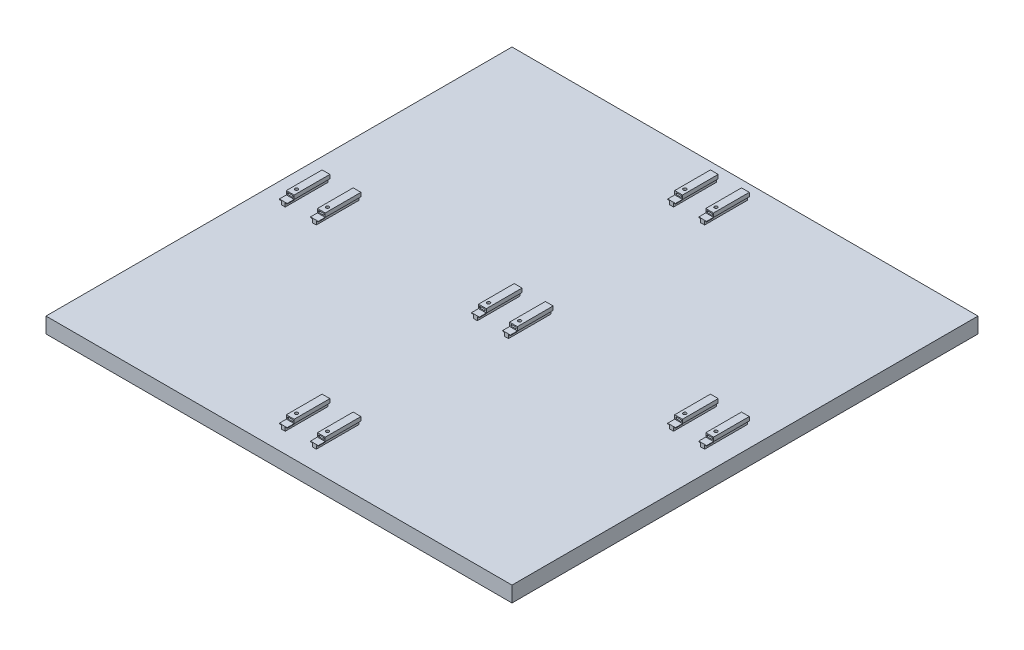
from build123d import *
from build123d.topology import SkipClean

# Parameters (mm, degrees)
SKETCH1_W                   = 300
SKETCH1_H                   = 300
BOSS_EXTRUDE1_DEPTH         = 10
SHELL5_T                    = -3
BOSS_EXTRUDE2_DEPTH         = 13.75
SKETCH5_W                   = 51.63175717
SKETCH5_H                   = 2.8
CUT_EXTRUDE1_DEPTH          = 4.5
SKETCH6_W                   = 5
SKETCH6_H                   = 4.5
BOSS_EXTRUDE3_DEPTH         = 0.35
SKETCH7_W                   = 3.5
SKETCH7_H                   = 1
CUT_EXTRUDE2_DEPTH          = 3.5
F_2_0_2_DIAMETER_HOLE2_D    = 2
SKETCH_PATTERN2_START       = 7
SKETCH_PATTERN2_OUTLINE_R   = 1
SKETCH_PATTERN2_DEPTH       = 3
SKETCH_PATTERN2_START_2     = 12.6
SKETCH_PATTERN2_2_DEPTH     = 2.5
SKETCH_PATTERN2_START_3     = 10
SKETCH_PATTERN2_3_OUTLINE_W = 2.5
SKETCH_PATTERN2_3_OUTLINE_H = 27.5
SKETCH_PATTERN2_3_OUTLINE_R = 1
SKETCH_PATTERN2_3_DEPTH     = 2.65
SKETCH_PATTERN2_START_4     = 14.35
SKETCH_PATTERN2_4_DEPTH     = 0.75
SKETCH_PATTERN2_5_DEPTH     = 0.75
SKETCH_PATTERN2_START_5     = 12.3
SKETCH_PATTERN2_6_OUTLINE_W = 1.25
SKETCH_PATTERN2_6_OUTLINE_H = 4.5
SKETCH_PATTERN2_6_DEPTH     = 0.35


# Read off the part's stored shape, not the designer's step: Sketch-Pattern2
with BuildPart() as part:
    # Sketch1 → Boss-Extrude1 (new body)
    with BuildSketch(Plane(origin=(0, 0, 0), x_dir=(1, 0, 0), z_dir=(0, 1, 0))):
        Rectangle(SKETCH1_W, SKETCH1_H)
    extrude(amount=BOSS_EXTRUDE1_DEPTH)

    # Shell5
    shell5_openings = [part.faces().sort_by_distance(p)[0] for p in [
        (0, 0, 0),
    ]]
    offset(amount=SHELL5_T, openings=shell5_openings, kind=Kind.INTERSECTION)

    # Sketch2 → Boss-Extrude2 (add, symmetric)
    with BuildSketch(Plane.XY):
        Polygon((-11.034760645, 10), (-11.034760645, 12.6), (-12.284760645, 12.6), (-12.284760645, 15.1), (-7.284760645, 15.1), (-7.284760645, 12.6), (-8.534760645, 12.6), (-8.534760645, 10), align=None)
        Polygon((8.965239355, 10), (11.465239355, 10), (11.465239355, 12.6), (12.715239355, 12.6), (12.715239355, 15.1), (7.715239355, 15.1), (7.715239355, 12.6), (8.965239355, 12.6), align=None)
    extrude(amount=BOSS_EXTRUDE2_DEPTH, both=True)

    # Sketch5 → Cut-Extrude1 (cut)
    with BuildSketch(Plane.XY.offset(13.75)):
        with Locations((-9.472877717, 13.7)):
            Rectangle(SKETCH5_W, SKETCH5_H)
        with Locations((17.311892559, -46.179704591)):
            Rectangle(SKETCH5_W, SKETCH5_H)
    extrude(amount=-CUT_EXTRUDE1_DEPTH, mode=Mode.SUBTRACT)

    # Sketch6 → Boss-Extrude3 (add)
    with BuildSketch(Plane(origin=(0, 12.3, 0), x_dir=(1, 0, 0), z_dir=(0, 1, 0))):
        with Locations((10.215239355, -11.5)):
            Rectangle(SKETCH6_W, SKETCH6_H)
        with Locations((-9.784760645, -11.5)):
            Rectangle(SKETCH6_W, SKETCH6_H)
    extrude(amount=BOSS_EXTRUDE3_DEPTH)

    # Sketch7 → Cut-Extrude2 (cut)
    with BuildSketch(Plane.XY.offset(9.25)):
        with Locations((10.215239355, 13.85)):
            Rectangle(SKETCH7_W, SKETCH7_H)
        with Locations((-9.784760645, 13.85)):
            Rectangle(SKETCH7_W, SKETCH7_H)
    extrude(amount=-CUT_EXTRUDE2_DEPTH, mode=Mode.SUBTRACT)

    # Ø2.0 (2) Diameter Hole2 (through all)
    with Locations(Plane(origin=(0, 15.1, 0), x_dir=(1, 0, 0), z_dir=(0, 1, 0))):
        with Locations((-9.784760645, -5.25), (10.215239355, -5.25)):
            Hole(F_2_0_2_DIAMETER_HOLE2_D / 2)

    # Sketch-Pattern2 outline → Sketch-Pattern2 (cut)
    with BuildSketch(Plane(origin=(0, 0, 0), x_dir=(1, 0, 0), z_dir=(0, 1, 0)).offset(SKETCH_PATTERN2_START)):
        with Locations((115, -3.75)):
            Circle(SKETCH_PATTERN2_OUTLINE_R)
        with Locations((135, -3.75)):
            Circle(SKETCH_PATTERN2_OUTLINE_R)
        with Locations((-135, -3.75)):
            Circle(SKETCH_PATTERN2_OUTLINE_R)
        with Locations((-115, -3.75)):
            Circle(SKETCH_PATTERN2_OUTLINE_R)
        with Locations((-10, -128.75)):
            Circle(SKETCH_PATTERN2_OUTLINE_R)
        with Locations((10, -128.75)):
            Circle(SKETCH_PATTERN2_OUTLINE_R)
        with Locations((-10, 121.25)):
            Circle(SKETCH_PATTERN2_OUTLINE_R)
        with Locations((10, 121.25)):
            Circle(SKETCH_PATTERN2_OUTLINE_R)
    extrude(amount=SKETCH_PATTERN2_DEPTH, mode=Mode.SUBTRACT)



with BuildPart() as body_2:
    # Sketch-Pattern2 2 outline → Sketch-Pattern2 2 (new body)
    with BuildSketch(Plane(origin=(0, 0, 0), x_dir=(1, 0, 0), z_dir=(0, 1, 0)).offset(SKETCH_PATTERN2_START_2)):
        with BuildLine():
            Line((115.866025404, -4.25), (116.75, -4.25))
            Line((116.75, -4.25), (116.75, -7.75))
            Line((116.75, -7.75), (117.5, -7.75))
            Line((117.5, -7.75), (117.5, 15.25))
            Line((117.5, 15.25), (112.5, 15.25))
            Line((112.5, 15.25), (112.5, -7.75))
            Line((112.5, -7.75), (113.25, -7.75))
            Line((113.25, -7.75), (113.25, -4.25))
            Line((113.25, -4.25), (114.133974596, -4.25))
            ThreePointArc((114.133974596, -4.25), (115, -2.75), (115.866025404, -4.25))
        make_face()
        with BuildLine():
            Line((135.866025404, -4.25), (136.75, -4.25))
            Line((136.75, -4.25), (136.75, -7.75))
            Line((136.75, -7.75), (137.5, -7.75))
            Line((137.5, -7.75), (137.5, 15.25))
            Line((137.5, 15.25), (132.5, 15.25))
            Line((132.5, 15.25), (132.5, -7.75))
            Line((132.5, -7.75), (133.25, -7.75))
            Line((133.25, -7.75), (133.25, -4.25))
            Line((133.25, -4.25), (134.133974596, -4.25))
            ThreePointArc((134.133974596, -4.25), (135, -2.75), (135.866025404, -4.25))
        make_face()
        with BuildLine():
            Line((-134.133974596, -4.25), (-133.25, -4.25))
            Line((-133.25, -4.25), (-133.25, -7.75))
            Line((-133.25, -7.75), (-132.5, -7.75))
            Line((-132.5, -7.75), (-132.5, 15.25))
            Line((-132.5, 15.25), (-137.5, 15.25))
            Line((-137.5, 15.25), (-137.5, -7.75))
            Line((-137.5, -7.75), (-136.75, -7.75))
            Line((-136.75, -7.75), (-136.75, -4.25))
            Line((-136.75, -4.25), (-135.866025404, -4.25))
            ThreePointArc((-135.866025404, -4.25), (-135, -2.75), (-134.133974596, -4.25))
        make_face()
        with BuildLine():
            Line((-114.133974596, -4.25), (-113.25, -4.25))
            Line((-113.25, -4.25), (-113.25, -7.75))
            Line((-113.25, -7.75), (-112.5, -7.75))
            Line((-112.5, -7.75), (-112.5, 15.25))
            Line((-112.5, 15.25), (-117.5, 15.25))
            Line((-117.5, 15.25), (-117.5, -7.75))
            Line((-117.5, -7.75), (-116.75, -7.75))
            Line((-116.75, -7.75), (-116.75, -4.25))
            Line((-116.75, -4.25), (-115.866025404, -4.25))
            ThreePointArc((-115.866025404, -4.25), (-115, -2.75), (-114.133974596, -4.25))
        make_face()
        with BuildLine():
            Line((-9.133974596, -129.25), (-8.25, -129.25))
            Line((-8.25, -129.25), (-8.25, -132.75))
            Line((-8.25, -132.75), (-7.5, -132.75))
            Line((-7.5, -132.75), (-7.5, -109.75))
            Line((-7.5, -109.75), (-12.5, -109.75))
            Line((-12.5, -109.75), (-12.5, -132.75))
            Line((-12.5, -132.75), (-11.75, -132.75))
            Line((-11.75, -132.75), (-11.75, -129.25))
            Line((-11.75, -129.25), (-10.866025404, -129.25))
            ThreePointArc((-10.866025404, -129.25), (-10, -127.75), (-9.133974596, -129.25))
        make_face()
        with BuildLine():
            Line((10.866025404, -129.25), (11.75, -129.25))
            Line((11.75, -129.25), (11.75, -132.75))
            Line((11.75, -132.75), (12.5, -132.75))
            Line((12.5, -132.75), (12.5, -109.75))
            Line((12.5, -109.75), (7.5, -109.75))
            Line((7.5, -109.75), (7.5, -132.75))
            Line((7.5, -132.75), (8.25, -132.75))
            Line((8.25, -132.75), (8.25, -129.25))
            Line((8.25, -129.25), (9.133974596, -129.25))
            ThreePointArc((9.133974596, -129.25), (10, -127.75), (10.866025404, -129.25))
        make_face()
        with BuildLine():
            Line((-9.133974596, 120.75), (-8.25, 120.75))
            Line((-8.25, 120.75), (-8.25, 117.25))
            Line((-8.25, 117.25), (-7.5, 117.25))
            Line((-7.5, 117.25), (-7.5, 140.25))
            Line((-7.5, 140.25), (-12.5, 140.25))
            Line((-12.5, 140.25), (-12.5, 117.25))
            Line((-12.5, 117.25), (-11.75, 117.25))
            Line((-11.75, 117.25), (-11.75, 120.75))
            Line((-11.75, 120.75), (-10.866025404, 120.75))
            ThreePointArc((-10.866025404, 120.75), (-10, 122.25), (-9.133974596, 120.75))
        make_face()
        with BuildLine():
            Line((10.866025404, 120.75), (11.75, 120.75))
            Line((11.75, 120.75), (11.75, 117.25))
            Line((11.75, 117.25), (12.5, 117.25))
            Line((12.5, 117.25), (12.5, 140.25))
            Line((12.5, 140.25), (7.5, 140.25))
            Line((7.5, 140.25), (7.5, 117.25))
            Line((7.5, 117.25), (8.25, 117.25))
            Line((8.25, 117.25), (8.25, 120.75))
            Line((8.25, 120.75), (9.133974596, 120.75))
            ThreePointArc((9.133974596, 120.75), (10, 122.25), (10.866025404, 120.75))
        make_face()
    extrude(amount=SKETCH_PATTERN2_2_DEPTH)


with BuildPart() as part_1:
    with SkipClean():  # the faces are left unmerged after this step: merging them gives an invalid solid
        add(part.part)

        add(body_2.part)  # Sketch-Pattern2 3 merges body 2
        # Sketch-Pattern2 3 outline → Sketch-Pattern2 3 (add)
        # profile 1 of 8: a face of its own
        with BuildSketch(Plane(origin=(0, 0, 0), x_dir=(1, 0, 0), z_dir=(0, 1, 0)).offset(SKETCH_PATTERN2_START_3)):
            with Locations((115, 1.5)):
                Rectangle(SKETCH_PATTERN2_3_OUTLINE_W, SKETCH_PATTERN2_3_OUTLINE_H)
            with Locations((115, -3.75)):
                Circle(SKETCH_PATTERN2_3_OUTLINE_R, mode=Mode.SUBTRACT)
        # profile 2 of 8: a face of its own
        with BuildSketch(Plane(origin=(0, 0, 0), x_dir=(1, 0, 0), z_dir=(0, 1, 0)).offset(SKETCH_PATTERN2_START_3)):
            with Locations((135, 1.5)):
                Rectangle(SKETCH_PATTERN2_3_OUTLINE_W, SKETCH_PATTERN2_3_OUTLINE_H)
            with Locations((135, -3.75)):
                Circle(SKETCH_PATTERN2_3_OUTLINE_R, mode=Mode.SUBTRACT)
        # profile 3 of 8: a face of its own
        with BuildSketch(Plane(origin=(0, 0, 0), x_dir=(1, 0, 0), z_dir=(0, 1, 0)).offset(SKETCH_PATTERN2_START_3)):
            with Locations((-135, 1.5)):
                Rectangle(SKETCH_PATTERN2_3_OUTLINE_W, SKETCH_PATTERN2_3_OUTLINE_H)
            with Locations((-135, -3.75)):
                Circle(SKETCH_PATTERN2_3_OUTLINE_R, mode=Mode.SUBTRACT)
        # profile 4 of 8: a face of its own
        with BuildSketch(Plane(origin=(0, 0, 0), x_dir=(1, 0, 0), z_dir=(0, 1, 0)).offset(SKETCH_PATTERN2_START_3)):
            with Locations((-115, 1.5)):
                Rectangle(SKETCH_PATTERN2_3_OUTLINE_W, SKETCH_PATTERN2_3_OUTLINE_H)
            with Locations((-115, -3.75)):
                Circle(SKETCH_PATTERN2_3_OUTLINE_R, mode=Mode.SUBTRACT)
        # profile 5 of 8: a face of its own
        with BuildSketch(Plane(origin=(0, 0, 0), x_dir=(1, 0, 0), z_dir=(0, 1, 0)).offset(SKETCH_PATTERN2_START_3)):
            with Locations((-10, -123.5)):
                Rectangle(SKETCH_PATTERN2_3_OUTLINE_W, SKETCH_PATTERN2_3_OUTLINE_H)
            with Locations((-10, -128.75)):
                Circle(SKETCH_PATTERN2_3_OUTLINE_R, mode=Mode.SUBTRACT)
        # profile 6 of 8: a face of its own
        with BuildSketch(Plane(origin=(0, 0, 0), x_dir=(1, 0, 0), z_dir=(0, 1, 0)).offset(SKETCH_PATTERN2_START_3)):
            with Locations((10, -123.5)):
                Rectangle(SKETCH_PATTERN2_3_OUTLINE_W, SKETCH_PATTERN2_3_OUTLINE_H)
            with Locations((10, -128.75)):
                Circle(SKETCH_PATTERN2_3_OUTLINE_R, mode=Mode.SUBTRACT)
        # profile 7 of 8: a face of its own
        with BuildSketch(Plane(origin=(0, 0, 0), x_dir=(1, 0, 0), z_dir=(0, 1, 0)).offset(SKETCH_PATTERN2_START_3)):
            with Locations((-10, 126.5)):
                Rectangle(SKETCH_PATTERN2_3_OUTLINE_W, SKETCH_PATTERN2_3_OUTLINE_H)
            with Locations((-10, 121.25)):
                Circle(SKETCH_PATTERN2_3_OUTLINE_R, mode=Mode.SUBTRACT)
        # profile 8 of 8: a face of its own
        with BuildSketch(Plane(origin=(0, 0, 0), x_dir=(1, 0, 0), z_dir=(0, 1, 0)).offset(SKETCH_PATTERN2_START_3)):
            with Locations((10, 126.5)):
                Rectangle(SKETCH_PATTERN2_3_OUTLINE_W, SKETCH_PATTERN2_3_OUTLINE_H)
            with Locations((10, 121.25)):
                Circle(SKETCH_PATTERN2_3_OUTLINE_R, mode=Mode.SUBTRACT)
        extrude(amount=SKETCH_PATTERN2_3_DEPTH)

    # Sketch-Pattern2 4 outline → Sketch-Pattern2 4 (add)
    with SkipClean():  # the faces are left unmerged after this step: merging them gives an invalid solid
        with BuildSketch(Plane(origin=(0, 0, 0), x_dir=(1, 0, 0), z_dir=(0, 1, 0)).offset(SKETCH_PATTERN2_START_4)):
            with BuildLine():
                ThreePointArc((115.866025404, -4.25), (115, -4.75), (114.133974596, -4.25))
                Line((114.133974596, -4.25), (113.25, -4.25))
                Line((113.25, -4.25), (113.25, -7.75))
                Line((113.25, -7.75), (116.75, -7.75))
                Line((116.75, -7.75), (116.75, -4.25))
                Line((116.75, -4.25), (115.866025404, -4.25))
            make_face()
            with BuildLine():
                ThreePointArc((135.866025404, -4.25), (135, -4.75), (134.133974596, -4.25))
                Line((134.133974596, -4.25), (133.25, -4.25))
                Line((133.25, -4.25), (133.25, -7.75))
                Line((133.25, -7.75), (136.75, -7.75))
                Line((136.75, -7.75), (136.75, -4.25))
                Line((136.75, -4.25), (135.866025404, -4.25))
            make_face()
            with BuildLine():
                ThreePointArc((-134.133974596, -4.25), (-135, -4.75), (-135.866025404, -4.25))
                Line((-135.866025404, -4.25), (-136.75, -4.25))
                Line((-136.75, -4.25), (-136.75, -7.75))
                Line((-136.75, -7.75), (-133.25, -7.75))
                Line((-133.25, -7.75), (-133.25, -4.25))
                Line((-133.25, -4.25), (-134.133974596, -4.25))
            make_face()
            with BuildLine():
                ThreePointArc((-114.133974596, -4.25), (-115, -4.75), (-115.866025404, -4.25))
                Line((-115.866025404, -4.25), (-116.75, -4.25))
                Line((-116.75, -4.25), (-116.75, -7.75))
                Line((-116.75, -7.75), (-113.25, -7.75))
                Line((-113.25, -7.75), (-113.25, -4.25))
                Line((-113.25, -4.25), (-114.133974596, -4.25))
            make_face()
            with BuildLine():
                ThreePointArc((-9.133974596, -129.25), (-10, -129.75), (-10.866025404, -129.25))
                Line((-10.866025404, -129.25), (-11.75, -129.25))
                Line((-11.75, -129.25), (-11.75, -132.75))
                Line((-11.75, -132.75), (-8.25, -132.75))
                Line((-8.25, -132.75), (-8.25, -129.25))
                Line((-8.25, -129.25), (-9.133974596, -129.25))
            make_face()
            with BuildLine():
                ThreePointArc((10.866025404, -129.25), (10, -129.75), (9.133974596, -129.25))
                Line((9.133974596, -129.25), (8.25, -129.25))
                Line((8.25, -129.25), (8.25, -132.75))
                Line((8.25, -132.75), (11.75, -132.75))
                Line((11.75, -132.75), (11.75, -129.25))
                Line((11.75, -129.25), (10.866025404, -129.25))
            make_face()
            with BuildLine():
                ThreePointArc((-9.133974596, 120.75), (-10, 120.25), (-10.866025404, 120.75))
                Line((-10.866025404, 120.75), (-11.75, 120.75))
                Line((-11.75, 120.75), (-11.75, 117.25))
                Line((-11.75, 117.25), (-8.25, 117.25))
                Line((-8.25, 117.25), (-8.25, 120.75))
                Line((-8.25, 120.75), (-9.133974596, 120.75))
            make_face()
            with BuildLine():
                ThreePointArc((10.866025404, 120.75), (10, 120.25), (9.133974596, 120.75))
                Line((9.133974596, 120.75), (8.25, 120.75))
                Line((8.25, 120.75), (8.25, 117.25))
                Line((8.25, 117.25), (11.75, 117.25))
                Line((11.75, 117.25), (11.75, 120.75))
                Line((11.75, 120.75), (10.866025404, 120.75))
            make_face()
        extrude(amount=SKETCH_PATTERN2_4_DEPTH)

    # Sketch-Pattern2 5 outline → Sketch-Pattern2 5 (add)
    with SkipClean():  # the faces are left unmerged after this step: merging them gives an invalid solid
        with BuildSketch(Plane(origin=(0, 0, 0), x_dir=(1, 0, 0), z_dir=(0, 1, 0)).offset(SKETCH_PATTERN2_START_2)):
            with BuildLine():
                ThreePointArc((115.866025404, -4.25), (115, -4.75), (114.133974596, -4.25))
                Line((114.133974596, -4.25), (113.25, -4.25))
                Line((113.25, -4.25), (113.25, -7.75))
                Line((113.25, -7.75), (116.75, -7.75))
                Line((116.75, -7.75), (116.75, -4.25))
                Line((116.75, -4.25), (115.866025404, -4.25))
            make_face()
            with BuildLine():
                ThreePointArc((135.866025404, -4.25), (135, -4.75), (134.133974596, -4.25))
                Line((134.133974596, -4.25), (133.25, -4.25))
                Line((133.25, -4.25), (133.25, -7.75))
                Line((133.25, -7.75), (136.75, -7.75))
                Line((136.75, -7.75), (136.75, -4.25))
                Line((136.75, -4.25), (135.866025404, -4.25))
            make_face()
            with BuildLine():
                ThreePointArc((-134.133974596, -4.25), (-135, -4.75), (-135.866025404, -4.25))
                Line((-135.866025404, -4.25), (-136.75, -4.25))
                Line((-136.75, -4.25), (-136.75, -7.75))
                Line((-136.75, -7.75), (-133.25, -7.75))
                Line((-133.25, -7.75), (-133.25, -4.25))
                Line((-133.25, -4.25), (-134.133974596, -4.25))
            make_face()
            with BuildLine():
                ThreePointArc((-114.133974596, -4.25), (-115, -4.75), (-115.866025404, -4.25))
                Line((-115.866025404, -4.25), (-116.75, -4.25))
                Line((-116.75, -4.25), (-116.75, -7.75))
                Line((-116.75, -7.75), (-113.25, -7.75))
                Line((-113.25, -7.75), (-113.25, -4.25))
                Line((-113.25, -4.25), (-114.133974596, -4.25))
            make_face()
            with BuildLine():
                ThreePointArc((-9.133974596, -129.25), (-10, -129.75), (-10.866025404, -129.25))
                Line((-10.866025404, -129.25), (-11.75, -129.25))
                Line((-11.75, -129.25), (-11.75, -132.75))
                Line((-11.75, -132.75), (-8.25, -132.75))
                Line((-8.25, -132.75), (-8.25, -129.25))
                Line((-8.25, -129.25), (-9.133974596, -129.25))
            make_face()
            with BuildLine():
                ThreePointArc((10.866025404, -129.25), (10, -129.75), (9.133974596, -129.25))
                Line((9.133974596, -129.25), (8.25, -129.25))
                Line((8.25, -129.25), (8.25, -132.75))
                Line((8.25, -132.75), (11.75, -132.75))
                Line((11.75, -132.75), (11.75, -129.25))
                Line((11.75, -129.25), (10.866025404, -129.25))
            make_face()
            with BuildLine():
                ThreePointArc((-9.133974596, 120.75), (-10, 120.25), (-10.866025404, 120.75))
                Line((-10.866025404, 120.75), (-11.75, 120.75))
                Line((-11.75, 120.75), (-11.75, 117.25))
                Line((-11.75, 117.25), (-8.25, 117.25))
                Line((-8.25, 117.25), (-8.25, 120.75))
                Line((-8.25, 120.75), (-9.133974596, 120.75))
            make_face()
            with BuildLine():
                ThreePointArc((10.866025404, 120.75), (10, 120.25), (9.133974596, 120.75))
                Line((9.133974596, 120.75), (8.25, 120.75))
                Line((8.25, 120.75), (8.25, 117.25))
                Line((8.25, 117.25), (11.75, 117.25))
                Line((11.75, 117.25), (11.75, 120.75))
                Line((11.75, 120.75), (10.866025404, 120.75))
            make_face()
        extrude(amount=SKETCH_PATTERN2_5_DEPTH)

    # Sketch-Pattern2 6 outline → Sketch-Pattern2 6 (add)
    with SkipClean():  # the faces are left unmerged after this step: merging them gives an invalid solid
        with BuildSketch(Plane(origin=(0, 0, 0), x_dir=(1, 0, 0), z_dir=(0, 1, 0)).offset(SKETCH_PATTERN2_START_5)):
            with Locations((116.875, -10)):
                Rectangle(SKETCH_PATTERN2_6_OUTLINE_W, SKETCH_PATTERN2_6_OUTLINE_H)
            with Locations((113.125, -10)):
                Rectangle(SKETCH_PATTERN2_6_OUTLINE_W, SKETCH_PATTERN2_6_OUTLINE_H)
            with Locations((136.875, -10)):
                Rectangle(SKETCH_PATTERN2_6_OUTLINE_W, SKETCH_PATTERN2_6_OUTLINE_H)
            with Locations((133.125, -10)):
                Rectangle(SKETCH_PATTERN2_6_OUTLINE_W, SKETCH_PATTERN2_6_OUTLINE_H)
            with Locations((-133.125, -10)):
                Rectangle(SKETCH_PATTERN2_6_OUTLINE_W, SKETCH_PATTERN2_6_OUTLINE_H)
            with Locations((-136.875, -10)):
                Rectangle(SKETCH_PATTERN2_6_OUTLINE_W, SKETCH_PATTERN2_6_OUTLINE_H)
            with Locations((-113.125, -10)):
                Rectangle(SKETCH_PATTERN2_6_OUTLINE_W, SKETCH_PATTERN2_6_OUTLINE_H)
            with Locations((-116.875, -10)):
                Rectangle(SKETCH_PATTERN2_6_OUTLINE_W, SKETCH_PATTERN2_6_OUTLINE_H)
            with Locations((-8.125, -135)):
                Rectangle(SKETCH_PATTERN2_6_OUTLINE_W, SKETCH_PATTERN2_6_OUTLINE_H)
            with Locations((-11.875, -135)):
                Rectangle(SKETCH_PATTERN2_6_OUTLINE_W, SKETCH_PATTERN2_6_OUTLINE_H)
            with Locations((11.875, -135)):
                Rectangle(SKETCH_PATTERN2_6_OUTLINE_W, SKETCH_PATTERN2_6_OUTLINE_H)
            with Locations((8.125, -135)):
                Rectangle(SKETCH_PATTERN2_6_OUTLINE_W, SKETCH_PATTERN2_6_OUTLINE_H)
            with Locations((-8.125, 115)):
                Rectangle(SKETCH_PATTERN2_6_OUTLINE_W, SKETCH_PATTERN2_6_OUTLINE_H)
            with Locations((-11.875, 115)):
                Rectangle(SKETCH_PATTERN2_6_OUTLINE_W, SKETCH_PATTERN2_6_OUTLINE_H)
            with Locations((11.875, 115)):
                Rectangle(SKETCH_PATTERN2_6_OUTLINE_W, SKETCH_PATTERN2_6_OUTLINE_H)
            with Locations((8.125, 115)):
                Rectangle(SKETCH_PATTERN2_6_OUTLINE_W, SKETCH_PATTERN2_6_OUTLINE_H)
        extrude(amount=SKETCH_PATTERN2_6_DEPTH)


solid = part_1.part
